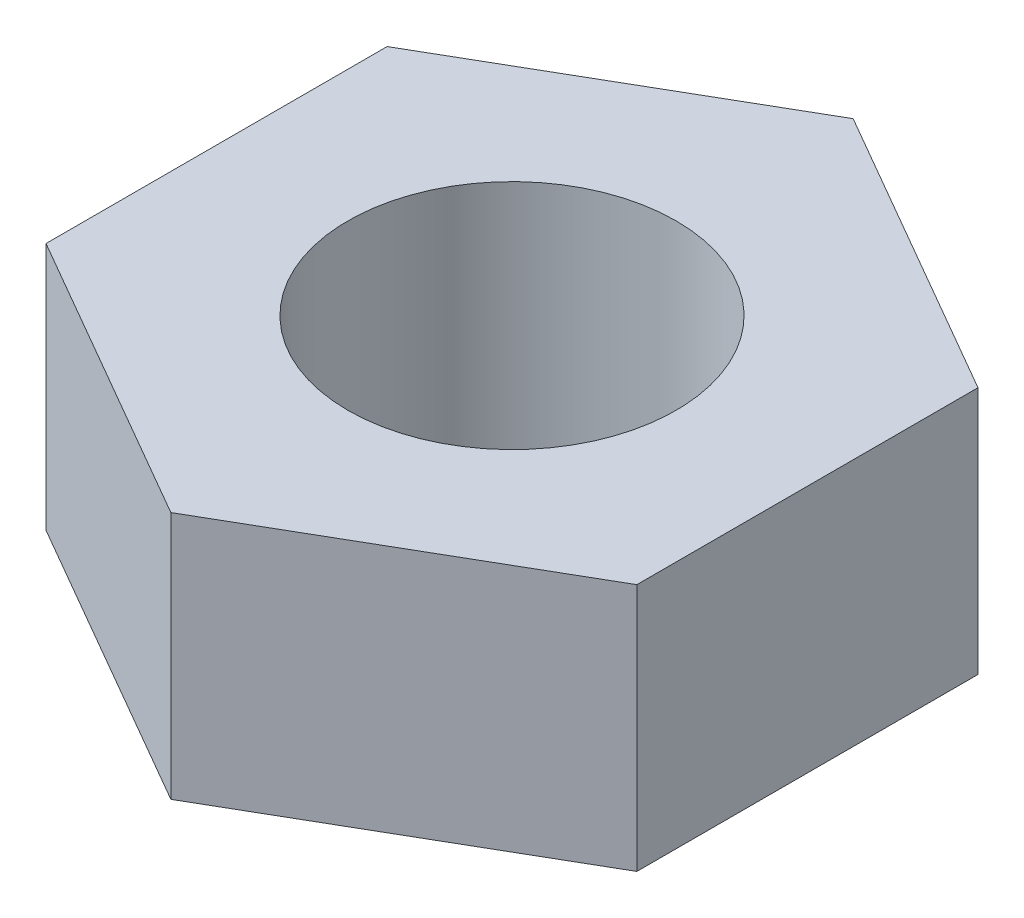
from build123d import *

# Parameters (mm, degrees)
SKETCH1_R           = 1.5
BOSS_EXTRUDE1_DEPTH = 2.27


with BuildPart() as part:
    # Sketch1 → Boss-Extrude1 (new body)
    with BuildSketch(Plane(origin=(0, 0, 0), x_dir=(1, 0, 0), z_dir=(0, 1, 0))):
        Polygon((0, -3.117691454), (2.7, -1.558845727), (2.7, 1.558845727), (0, 3.117691454), (-2.7, 1.558845727), (-2.7, -1.558845727), align=None)
        Circle(SKETCH1_R, mode=Mode.SUBTRACT)
    extrude(amount=BOSS_EXTRUDE1_DEPTH)


solid = part.part
